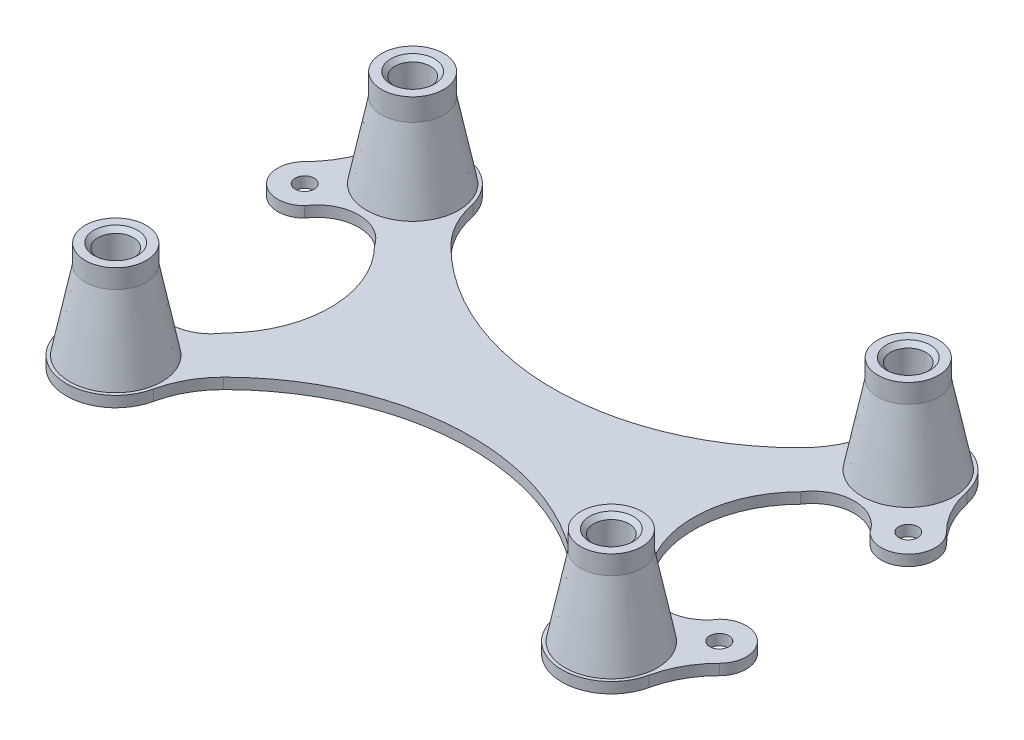
from build123d import *

# Parameters (mm, degrees)
BOSS_EXTRUDE1_DEPTH   = 2.54
SKETCH1_4_R           = 7.325
SKETCH1_4_R_2         = 4.15
SKETCH1_4_R_3         = 7.175
BOSS_EXTRUDE2_DEPTH   = 25.4
F_8_CLEARANCE_HOLE2_D = 4.4958
LPATTERN1_COUNT       = 2
LPATTERN1_PITCH       = 116.586
LPATTERN1_COUNT_DIR2  = 2
LPATTERN1_PITCH_DIR2  = 69.85
CHAMFER1_SIZE         = 1


with BuildPart() as part:
    # Sketch1 → Boss-Extrude1 (new body)
    with BuildSketch(Plane(origin=(0, 0, 0), x_dir=(1, 0, 0), z_dir=(0, 1, 0))):
        with BuildLine():
            ThreePointArc((8.209871939, -17.190128061), (15.555896424, -34.925), (8.209871939, -52.659871939))
            ThreePointArc((8.209871939, -52.659871939), (0, -57.15), (-8.209871939, -52.659871939))
            ThreePointArc((-8.209871939, -52.659871939), (-17.190128061, -52.659871939), (-17.190128061, -61.640128061))
            ThreePointArc((-17.190128061, -61.640128061), (-13.499098781, -66.567297756), (-11.341832503, -72.333310292))
            ThreePointArc((-11.341832503, -72.333310292), (0, -81.460512242), (11.341832503, -72.333310292))
            ThreePointArc((11.341832503, -72.333310292), (13.499098781, -66.567297756), (17.190128061, -61.640128061))
            ThreePointArc((17.190128061, -61.640128061), (58.293, -44.614761051), (99.395871939, -61.640128061))
            ThreePointArc((99.395871939, -61.640128061), (103.086901219, -66.567297756), (105.244167497, -72.333310292))
            ThreePointArc((105.244167497, -72.333310292), (116.586, -81.460512242), (127.927832503, -72.333310292))
            ThreePointArc((127.927832503, -72.333310292), (130.085098781, -66.567297756), (133.776128061, -61.640128061))
            ThreePointArc((133.776128061, -61.640128061), (133.776128061, -52.659871939), (124.795871939, -52.659871939))
            ThreePointArc((124.795871939, -52.659871939), (116.586, -57.15), (108.376128061, -52.659871939))
            ThreePointArc((108.376128061, -52.659871939), (101.030103576, -34.925), (108.376128061, -17.190128061))
            ThreePointArc((108.376128061, -17.190128061), (116.586, -12.7), (124.795871939, -17.190128061))
            ThreePointArc((124.795871939, -17.190128061), (133.776128061, -17.190128061), (133.776128061, -8.209871939))
            ThreePointArc((133.776128061, -8.209871939), (130.085098781, -3.282702244), (127.927832503, 2.483310292))
            ThreePointArc((127.927832503, 2.483310292), (116.825136798, 11.608049281), (105.356064016, 2.948310079))
            ThreePointArc((105.356064016, 2.948310079), (103.204339104, -3.073259016), (99.395871939, -8.209871939))
            ThreePointArc((99.395871939, -8.209871939), (58.293, -25.235238949), (17.190128061, -8.209871939))
            ThreePointArc((17.190128061, -8.209871939), (13.381660896, -3.073259016), (11.229935984, 2.948310079))
            ThreePointArc((11.229935984, 2.948310079), (-0.239136798, 11.608049281), (-11.341832503, 2.483310292))
            ThreePointArc((-11.341832503, 2.483310292), (-13.499098781, -3.282702244), (-17.190128061, -8.209871939))
            ThreePointArc((-17.190128061, -8.209871939), (-17.190128061, -17.190128061), (-8.209871939, -17.190128061))
            ThreePointArc((-8.209871939, -17.190128061), (0, -12.7), (8.209871939, -17.190128061))
        make_face()
    extrude(amount=BOSS_EXTRUDE1_DEPTH)

    # Sketch1<4> → Boss-Extrude2 (add)
    # profile 1 of 4: a face of its own
    with BuildSketch(Plane(origin=(0, 0, 0), x_dir=(1, 0, 0), z_dir=(0, 1, 0))):
        Circle(SKETCH1_4_R)
        Circle(SKETCH1_4_R_2, mode=Mode.SUBTRACT)
    # profile 2 of 4: a face of its own
    with BuildSketch(Plane(origin=(0, 0, 0), x_dir=(1, 0, 0), z_dir=(0, 1, 0))):
        with Locations((116.586, 0)):
            Circle(SKETCH1_4_R_3)
        with Locations((116.586, 0)):
            Circle(SKETCH1_4_R_2, mode=Mode.SUBTRACT)
    # profile 3 of 4: a face of its own
    with BuildSketch(Plane(origin=(0, 0, 0), x_dir=(1, 0, 0), z_dir=(0, 1, 0))):
        with Locations((0, -69.85)):
            Circle(SKETCH1_4_R_3)
        with Locations((0, -69.85)):
            Circle(SKETCH1_4_R_2, mode=Mode.SUBTRACT)
    # profile 4 of 4: a face of its own
    with BuildSketch(Plane(origin=(0, 0, 0), x_dir=(1, 0, 0), z_dir=(0, 1, 0))):
        with Locations((116.586, -69.85)):
            Circle(SKETCH1_4_R_3)
        with Locations((116.586, -69.85)):
            Circle(SKETCH1_4_R_2, mode=Mode.SUBTRACT)
    extrude(amount=BOSS_EXTRUDE2_DEPTH)

    # #8 Clearance Hole2 (through all)
    with Locations(Plane(origin=(0, 2.54, 0), x_dir=(1, 0, 0), z_dir=(0, 1, 0))):
        with Locations((129.286, -12.7), (129.286, -57.15), (-12.7, -57.15), (-12.7, -12.7)):
            Hole(F_8_CLEARANCE_HOLE2_D / 2)

    # Sketch8 → Revolve1 (revolve)
    with BuildSketch(Plane(origin=(0, 0, 0), x_dir=(0, 0, -1), z_dir=(1, 0, 0))):
        Polygon((10.856911267, 2.54), (7.046911267, 21.59), (7.046911267, 2.54), align=None)
    revolve1 = revolve(axis=Axis((0, 0, 0), (0, 1, 0)))

    # LPattern1: Revolve1 2 × 2
    with Locations(*[(i * LPATTERN1_PITCH, 0, j * LPATTERN1_PITCH_DIR2) for i in range(LPATTERN1_COUNT) for j in range(LPATTERN1_COUNT_DIR2) if (i, j) != (0, 0)]):
        add(revolve1)

    # Chamfer1
    chamfer1_edges = [part.edges().sort_by_distance(p)[0] for p in [
        (112.436, 25.4, 69.85),
        (112.436, 25.4, 0),
        (-4.15, 25.4, 69.85),
        (-4.15, 25.4, 0),
    ]]
    chamfer(chamfer1_edges, length=CHAMFER1_SIZE)


solid = part.part
